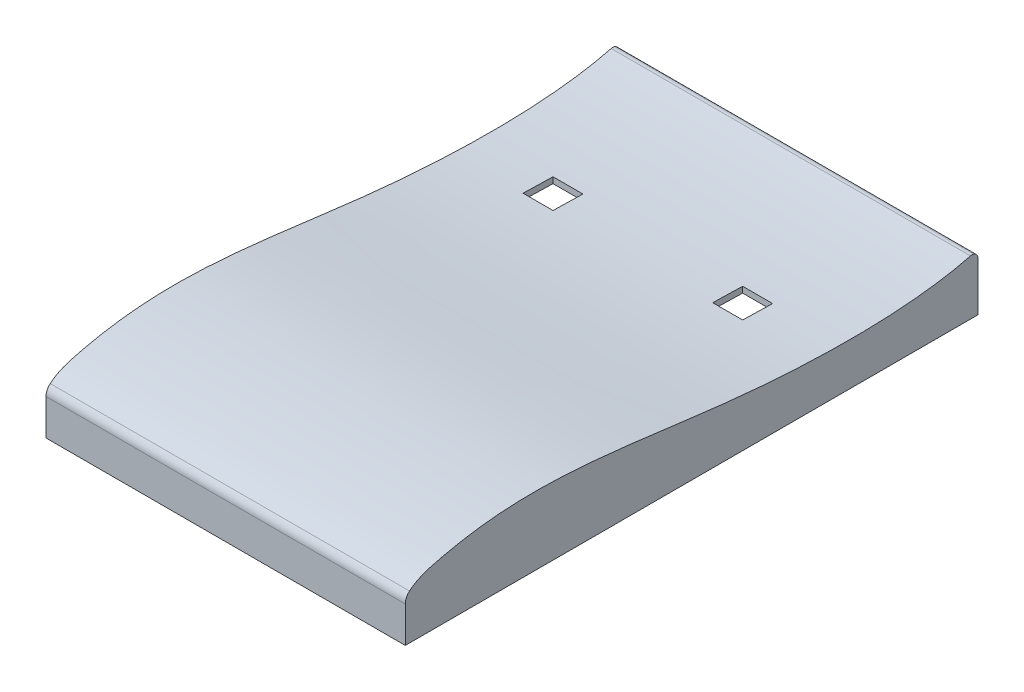
from build123d import *

# Parameters (mm, degrees)
EXTRUDE_2_DEPTH     = 60
SHELL_START         = 1
SHELL_3_DEPTH       = 58
SKETCH_7_W          = 5
SKETCH_7_H          = 5
CUT_EXTRUDE_3_DEPTH = 60


# Read off the part's stored shape, not the designer's step: 쉘3
with BuildPart() as part:
    # 스케치6 → 보스-돌출2 (new body)
    with BuildSketch(Plane(origin=(0, 0, 0), x_dir=(0, 0, -1), z_dir=(1, 0, 0))):
        with BuildLine():
            Line((0, 0), (0, -6))
            Line((0, -6), (95.63466571, -6))
            Line((95.63466571, -6), (95.63466571, 2.175395266))
            ThreePointArc((95.63466571, 2.175395266), (95.245185992, 2.967395888), (94.380135739, 3.142460151))
            add(Edge.make_bspline(
                [(0.702849582, 1.522301151), (1.987609821, 2.617043331), (15.799746275, 6.70455465), (31.076303093, 5.242526232), (65.734818972, 0.602742413), (84.47693769, 0.535953852), (94.380135739, 3.142460151)],
                knots=[0.002176589, 0.002176589, 0.002176589, 0.002176589, 0.049494346, 0.428561141, 0.517584616, 0.939729093, 0.939729093, 0.939729093, 0.939729093], degree=3))
            ThreePointArc((0.702849582, 1.522301151), (0.184194279, 0.838361248), (0, 0))
        make_face()
    extrude(amount=EXTRUDE_2_DEPTH)

    # 쉘3 outline → 쉘3 (cut)
    with BuildSketch(Plane.YZ.offset(SHELL_START)):
        with BuildLine():
            Line((-6, -94.63466571), (2.175395266, -94.63466571))
            add(Edge.make_bspline(
                [(2.175395266, -94.63466571), (1.770681014, -93.096988481), (1.413684485, -91.470128058), (1.102517603, -89.758279158), (0.835662784, -87.965753295), (0.611820358, -86.096982301), (0.429813499, -84.156506405), (0.288536305, -82.148953239), (0.186930649, -80.07901408), (0.123977434, -77.951423695), (0.098687885, -75.770950119), (0.115776823, -72.428125993), (0.130643483, -71.301831309), (0.154559084, -70.164117989), (0.187402827, -69.015588536), (0.22905452, -67.856846614), (0.27939458, -66.688497046), (0.33830403, -65.511145819), (0.405664502, -64.325400081), (0.481358234, -63.13186814), (0.565268075, -61.931159467), (0.70328218, -60.120247305), (0.751311568, -59.514968021), (0.801351088, -58.908123222), (0.853386185, -58.299789287), (0.907402305, -57.690042598), (0.963384893, -57.078959534), (1.021319395, -56.466616477), (1.081191255, -55.853089807), (1.142985921, -55.238455903), (1.206688837, -54.622791148), (1.288684601, -53.852017114), (1.305201669, -53.697804419), (1.321839163, -53.54352385), (1.338589959, -53.389206291), (1.355461891, -53.234815338), (1.372453449, -53.080361826), (1.389557068, -52.925880596), (1.406776962, -52.771345487), (1.424122688, -52.616713407), (1.441577584, -52.462081655), (1.476708219, -52.152747168), (1.494383406, -51.998050723), (1.51216523, -51.843330204), (1.530050457, -51.688590739), (1.548035854, -51.533837455), (1.566118188, -51.37907548), (1.584294225, -51.224309942), (1.602560731, -51.069545967), (1.620914473, -50.914788684), (1.639352219, -50.760043221), (1.694907763, -50.29585767), (1.732267884, -49.986468511), (1.769925251, -49.677188369), (1.807854028, -49.36805844), (1.846028382, -49.059119979), (1.884422491, -48.750414297), (1.923010537, -48.441982764), (1.961766708, -48.133866804), (2.000665202, -47.8261079), (2.039680221, -47.518747591), (2.117891726, -46.904907357), (2.157088212, -46.598427437), (2.196349636, -46.292429305), (2.235650213, -45.986954612), (2.274964159, -45.682045071), (2.314265697, -45.377742456), (2.353529053, -45.074088606), (2.39272846, -44.771125417), (2.431838155, -44.468894851), (2.470832381, -44.167438928), (2.529111886, -43.716480135), (2.548503351, -43.566363452), (2.567855852, -43.416458317), (2.587166424, -43.266768743), (2.60643229, -43.117297895), (2.625650391, -42.968050321), (2.644817239, -42.819032667), (2.663929074, -42.67025285), (2.682982337, -42.521717713), (2.701974461, -42.373429144), (2.739835474, -42.077328191), (2.758704438, -41.929516838), (2.777510653, -41.781943325), (2.796252912, -41.634606366), (2.814930007, -41.487504679), (2.83354073, -41.340636978), (2.852083876, -41.194001979), (2.870558235, -41.047598398), (2.888962602, -40.901424951), (2.907295768, -40.755480353), (2.998599563, -40.026895191), (3.070484142, -39.44766804), (3.141133063, -38.871999694), (3.210469252, -38.299807891), (3.278415762, -37.731010291), (3.34489577, -37.165524465), (3.40983258, -36.603267904), (3.473149623, -36.044158013), (3.534770454, -35.488112117), (3.594618757, -34.935047454), (3.768617502, -33.284548632), (3.877222121, -32.195809443), (3.977822396, -31.118000272), (4.069811361, -30.050455789), (4.152584685, -28.992508124), (4.225540472, -27.943486303), (4.288079063, -26.902715686), (4.339602837, -25.86951741), (4.379516013, -24.843207826), (4.407224446, -23.823097942), (4.437046427, -21.793887776), (4.43915972, -20.784786984), (4.427881943, -19.780496885), (4.402620672, -18.780316923), (4.362783563, -17.783540019), (4.307777491, -16.789452993), (4.23700769, -15.797336993), (4.149876887, -14.806467925), (4.045784439, -13.816116875), (3.924125473, -12.825550542), (3.714372296, -11.338272223), (3.639910456, -10.842274972), (3.560828315, -10.345947661), (3.477049362, -9.849198026), (3.388496769, -9.351933784), (3.295093384, -8.854062637), (3.196761735, -8.35549227), (3.093424029, -7.856130352), (2.985002153, -7.355884532), (2.871417672, -6.854662447), (2.737738598, -6.289585372), (2.722803472, -6.226782335), (2.707786296, -6.163962424), (2.692686916, -6.101125458), (2.677505178, -6.038271257), (2.662240928, -5.975399642), (2.646894011, -5.912510434), (2.631464274, -5.849603451), (2.615951563, -5.786678515), (2.600355723, -5.723735445), (2.57683704, -5.62929337), (2.568976658, -5.5978081), (2.561095436, -5.56631823), (2.553193354, -5.534823736), (2.545270394, -5.503324597), (2.537326536, -5.471820789), (2.529361761, -5.440312291), (2.521376049, -5.40879908), (2.513369381, -5.377281134), (2.505341738, -5.34575843), (2.489244462, -5.28270346), (2.481172693, -5.251163745), (2.473078983, -5.21960803), (2.465041534, -5.188370323), (2.456853771, -5.156625719), (2.448822149, -5.12559968), (2.440623142, -5.094020235), (2.43249917, -5.062848536), (2.424315423, -5.031561649), (2.416120941, -5.000358382), (2.375027297, -4.844528031), (2.341786416, -4.720544675), (2.308084722, -4.597286229), (2.2738297, -4.474796804), (2.238931047, -4.353120296), (2.203300556, -4.232300035), (2.166852, -4.112378447), (2.129501015, -3.993396698), (2.091164987, -3.87539436), (2.051762931, -3.758409055), (1.93012027, -3.410610239), (1.844442065, -3.182953982), (1.753546417, -2.95978673), (1.656812042, -2.741351983), (1.553632639, -2.527838215), (1.443399184, -2.319362179), (1.325470422, -2.115958914), (1.199139454, -1.917582669), (1.063604236, -1.724123001), (0.917949877, -1.535440272), (0.761150575, -1.351424791)],
                knots=[0.002176589, 0.002176589, 0.002176589, 0.002176589, 0.002176589, 0.002176589, 0.002176589, 0.002176589, 0.002176589, 0.002176589, 0.002176589, 0.002176589, 0.236564715, 0.236564715, 0.236564715, 0.236564715, 0.236564715, 0.236564715, 0.236564715, 0.236564715, 0.236564715, 0.236564715, 0.353758778, 0.353758778, 0.353758778, 0.353758778, 0.353758778, 0.353758778, 0.353758778, 0.353758778, 0.353758778, 0.353758778, 0.412355809, 0.412355809, 0.412355809, 0.412355809, 0.412355809, 0.412355809, 0.412355809, 0.412355809, 0.412355809, 0.412355809, 0.427005067, 0.427005067, 0.427005067, 0.427005067, 0.427005067, 0.427005067, 0.427005067, 0.427005067, 0.427005067, 0.427005067, 0.441654325, 0.441654325, 0.441654325, 0.441654325, 0.441654325, 0.441654325, 0.441654325, 0.441654325, 0.441654325, 0.441654325, 0.470952841, 0.470952841, 0.470952841, 0.470952841, 0.470952841, 0.470952841, 0.470952841, 0.470952841, 0.470952841, 0.470952841, 0.500251356, 0.500251356, 0.500251356, 0.500251356, 0.500251356, 0.500251356, 0.500251356, 0.500251356, 0.500251356, 0.500251356, 0.514900614, 0.514900614, 0.514900614, 0.514900614, 0.514900614, 0.514900614, 0.514900614, 0.514900614, 0.514900614, 0.514900614, 0.529549872, 0.529549872, 0.529549872, 0.529549872, 0.529549872, 0.529549872, 0.529549872, 0.529549872, 0.529549872, 0.529549872, 0.588146904, 0.588146904, 0.588146904, 0.588146904, 0.588146904, 0.588146904, 0.588146904, 0.588146904, 0.588146904, 0.588146904, 0.705340967, 0.705340967, 0.705340967, 0.705340967, 0.705340967, 0.705340967, 0.705340967, 0.705340967, 0.705340967, 0.705340967, 0.82253503, 0.82253503, 0.82253503, 0.82253503, 0.82253503, 0.82253503, 0.82253503, 0.82253503, 0.82253503, 0.82253503, 0.881132061, 0.881132061, 0.881132061, 0.881132061, 0.881132061, 0.881132061, 0.881132061, 0.881132061, 0.881132061, 0.881132061, 0.88845669, 0.88845669, 0.88845669, 0.88845669, 0.88845669, 0.88845669, 0.88845669, 0.88845669, 0.88845669, 0.88845669, 0.892119004, 0.892119004, 0.892119004, 0.892119004, 0.892119004, 0.892119004, 0.892119004, 0.892119004, 0.892119004, 0.892119004, 0.895781319, 0.895781319, 0.895781319, 0.895781319, 0.895781319, 0.895781319, 0.895781319, 0.895781319, 0.895781319, 0.895781319, 0.910430577, 0.910430577, 0.910430577, 0.910430577, 0.910430577, 0.910430577, 0.910430577, 0.910430577, 0.910430577, 0.910430577, 0.939729093, 0.939729093, 0.939729093, 0.939729093, 0.939729093, 0.939729093, 0.939729093, 0.939729093, 0.939729093, 0.939729093, 0.939729093, 0.939729093], degree=11))
            ThreePointArc((0.761150575, -1.351424791), (0.419180624, -1.092097139), (0, -1))
            Line((0, -1), (-6, -1))
            Line((-6, -1), (-6, -94.63466571))
        make_face()
    extrude(amount=SHELL_3_DEPTH, mode=Mode.SUBTRACT)

    # 스케치7 → 컷-돌출3 (cut)
    with BuildSketch(Plane.XZ.offset(6)):
        with Locations((14.164653363, -70.5)):
            Rectangle(SKETCH_7_W, SKETCH_7_H)
        with Locations((45.835346637, -70.5)):
            Rectangle(SKETCH_7_W, SKETCH_7_H)
    extrude(amount=-CUT_EXTRUDE_3_DEPTH, mode=Mode.SUBTRACT)


solid = part.part
